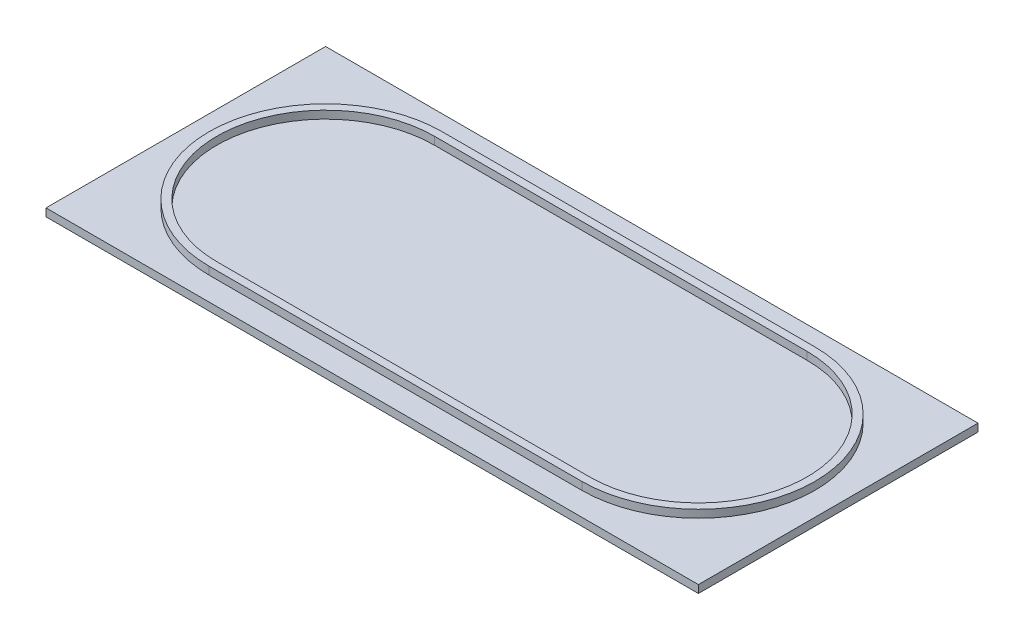
from build123d import *

# Parameters (mm, degrees)
TRAIN_TRACK_DEPTH   = 12.7
TRACK_BASE_SKETCH_W = 1066.8
TRACK_BASE_SKETCH_H = 457.2
TRACK_BASE_DEPTH    = 12.7


with BuildPart() as part:
    # Track Sketch → Train Track (new body)
    with BuildSketch(Plane(origin=(0, 0, 0), x_dir=(1, 0, 0), z_dir=(0, 1, 0))):
        with BuildLine():
            Line((-304.8, -190.5), (304.8, -190.5))
            ThreePointArc((304.8, -190.5), (495.3, 0), (304.8, 190.5))
            Line((304.8, 190.5), (-304.8, 190.5))
            ThreePointArc((-304.8, 190.5), (-495.3, 0), (-304.8, -190.5))
        make_face()
        with BuildLine():
            Line((-304.8, -177.8), (304.8, -177.8))
            ThreePointArc((304.8, -177.8), (482.6, 0), (304.8, 177.8))
            Line((304.8, 177.8), (-304.8, 177.8))
            ThreePointArc((-304.8, 177.8), (-482.6, 0), (-304.8, -177.8))
        make_face(mode=Mode.SUBTRACT)
    extrude(amount=TRAIN_TRACK_DEPTH)

    # Track Base Sketch → Track Base (add)
    with BuildSketch(Plane(origin=(0, 0, 0), x_dir=(1, 0, 0), z_dir=(0, 1, 0))):
        Rectangle(TRACK_BASE_SKETCH_W, TRACK_BASE_SKETCH_H)
    extrude(amount=-TRACK_BASE_DEPTH)


solid = part.part
